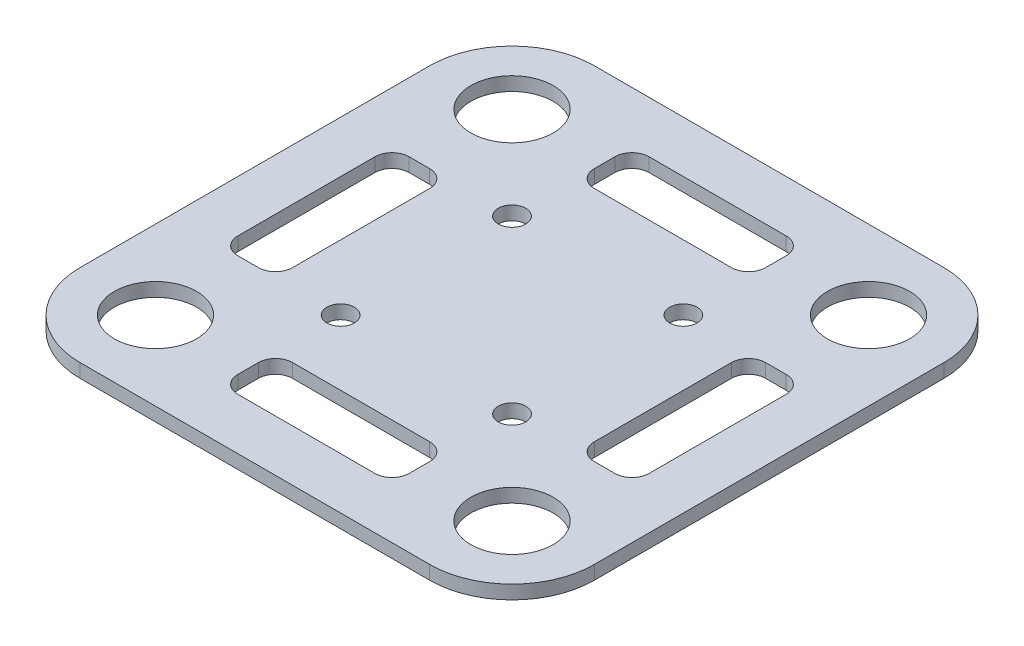
from build123d import *

# Parameters (mm, degrees)
SKETCH_1_W             = 75
SKETCH_1_H             = 75
SKETCH_1_R             = 6
SKETCH_1_R_2           = 2
SKETCH_1_W_2           = 8
SKETCH_1_H_2           = 25
SKETCH_1_W_3           = 25
SKETCH_1_H_3           = 8
SM_BASE_FLANGE_1_DEPTH = 2
FILLET_1_R             = 12
FILLET_2_R             = 2.5


# Sheet-metal steps are written as plain solids
with BuildPart() as part:
    # Sketch 1 → 基体-法兰1 (new body)
    with BuildSketch(Plane(origin=(0, 0, 0), x_dir=(1, 0, 0), z_dir=(0, 1, 0))):
        Rectangle(SKETCH_1_W, SKETCH_1_H)
        with Locations(Location((26, 26, 0), (0, 0, 270))):
            Circle(SKETCH_1_R, mode=Mode.SUBTRACT)
        with Locations(Location((26, -26, 0), (0, 0, 270))):
            Circle(SKETCH_1_R, mode=Mode.SUBTRACT)
        with Locations(Location((-26, -26, 0), (0, 0, 270))):
            Circle(SKETCH_1_R, mode=Mode.SUBTRACT)
        with Locations(Location((-26, 26, 0), (0, 0, 270))):
            Circle(SKETCH_1_R, mode=Mode.SUBTRACT)
        with Locations(Location((-12.5, 12.5, 0), (0, 0, 270))):
            Circle(SKETCH_1_R_2, mode=Mode.SUBTRACT)
        with Locations(Location((12.5, 12.5, 0), (0, 0, 270))):
            Circle(SKETCH_1_R_2, mode=Mode.SUBTRACT)
        with Locations(Location((12.5, -12.5, 0), (0, 0, 270))):
            Circle(SKETCH_1_R_2, mode=Mode.SUBTRACT)
        with Locations(Location((-12.5, -12.5, 0), (0, 0, 270))):
            Circle(SKETCH_1_R_2, mode=Mode.SUBTRACT)
        with Locations((26, 0)):
            Rectangle(SKETCH_1_W_2, SKETCH_1_H_2, mode=Mode.SUBTRACT)
        with Locations((0, 26)):
            Rectangle(SKETCH_1_W_3, SKETCH_1_H_3, mode=Mode.SUBTRACT)
        with Locations((0, -26)):
            Rectangle(SKETCH_1_W_3, SKETCH_1_H_3, mode=Mode.SUBTRACT)
        with Locations((-26, 0)):
            Rectangle(SKETCH_1_W_2, SKETCH_1_H_2, mode=Mode.SUBTRACT)
    extrude(amount=-SM_BASE_FLANGE_1_DEPTH)

    # 圆角1
    fillet_1_edges = [part.edges().sort_by_distance(p)[0] for p in [
        (-37.5, -1, -37.5),
        (37.5, -1, -37.5),
        (37.5, -1, 37.5),
        (-37.5, -1, 37.5),
    ]]
    fillet(fillet_1_edges, radius=FILLET_1_R)

    # 圆角2
    fillet_2_edges = [part.edges().sort_by_distance(p)[0] for p in [
        (-12.5, -1, -22),
        (-12.5, -1, -30),
        (12.5, -1, -30),
        (12.5, -1, -22),
        (30, -1, -12.5),
        (30, -1, 12.5),
        (22, -1, 12.5),
        (22, -1, -12.5),
        (12.5, -1, 30),
        (-12.5, -1, 30),
        (-12.5, -1, 22),
        (12.5, -1, 22),
        (-30, -1, 12.5),
        (-30, -1, -12.5),
        (-22, -1, -12.5),
        (-22, -1, 12.5),
    ]]
    fillet(fillet_2_edges, radius=FILLET_2_R)


solid = part.part
